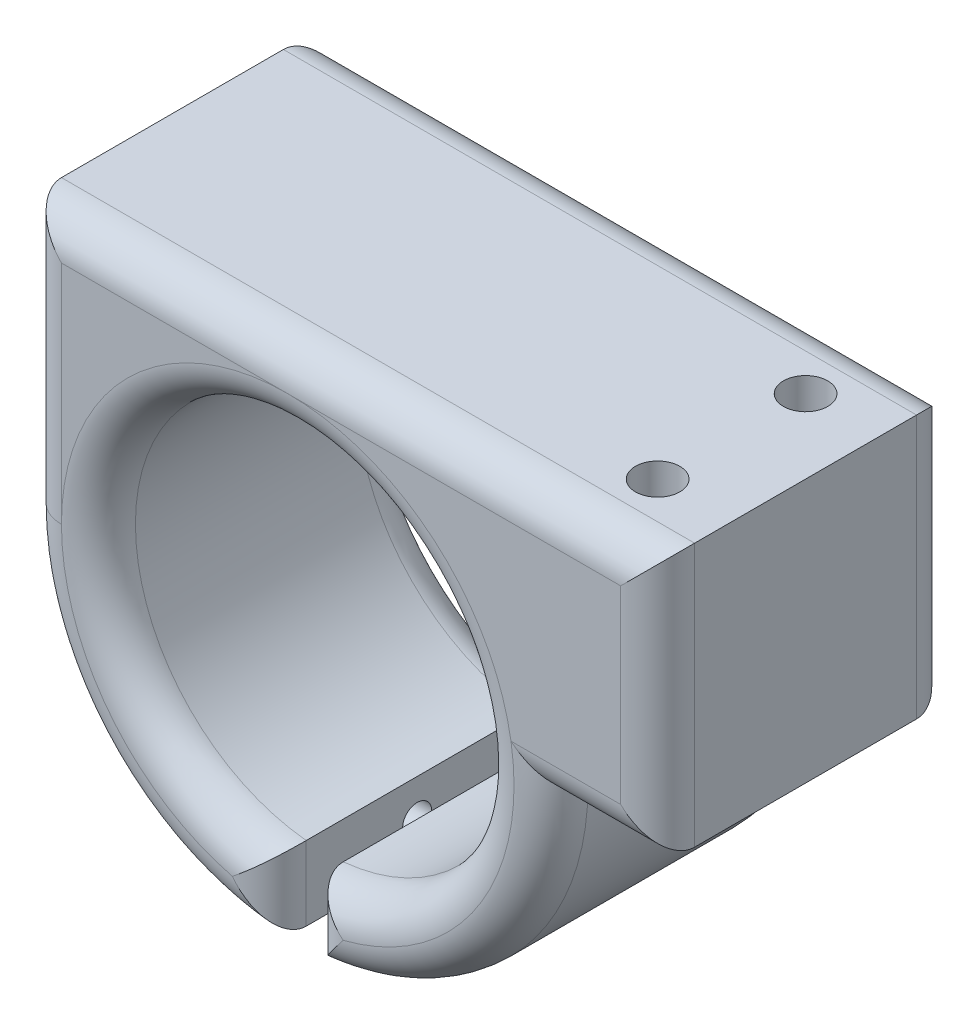
from build123d import *

# Parameters (mm, degrees)
SKETCH2_W           = 25.4
SKETCH2_H           = 50.8
SKETCH2_R           = 3.81
BOSS_EXTRUDE1_DEPTH = 25.4
BOSS_EXTRUDE2_DEPTH = 25.4
CUT_EXTRUDE1_DEPTH  = 170.18
CUT_EXTRUDE2_DEPTH  = 170.18
SKETCH5_3_W         = 19.05
SKETCH5_3_H         = 8.255
SKETCH5_3_R         = 2.5
CUT_EXTRUDE3_DEPTH  = 32.004
SKETCH6_R           = 3.81
CUT_EXTRUDE4_DEPTH  = 32.004
FILLET1_R           = 6.35


with BuildPart() as part:
    # Sketch2 → Boss-Extrude1 (new body)
    with BuildSketch(Plane(origin=(0, 0, 0), x_dir=(1, 0, 0), z_dir=(0, 1, 0))):
        with Locations((-31.75, 0)):
            Rectangle(SKETCH2_W, SKETCH2_H)
        with Locations(Location((-31.75, -12.7, 0), (0, 0, 270))):
            Circle(SKETCH2_R, mode=Mode.SUBTRACT)
        with Locations(Location((-31.75, 12.7, 0), (0, 0, 270))):
            Circle(SKETCH2_R, mode=Mode.SUBTRACT)
    extrude(amount=-BOSS_EXTRUDE1_DEPTH)

    # Sketch3 → Boss-Extrude2 (add, symmetric)
    with BuildSketch(Plane.XY):
        with BuildLine():
            Line((-44.45, -25.4), (-44.45, 0))
            Line((-44.45, 0), (-127.75, 0))
            Line((-127.75, 0), (-127.75, -45.2))
            Line((-127.75, -45.2), (-115.05, -45.2))
            ThreePointArc((-115.05, -45.2), (-82.55, -12.7), (-50.05, -45.2))
            Line((-50.05, -45.2), (-37.35, -45.2))
            Line((-37.35, -45.2), (-19.05, -45.2))
            Line((-19.05, -45.2), (-19.05, -25.4))
            Line((-19.05, -25.4), (-44.45, -25.4))
        make_face()
        with BuildLine():
            Line((-115.05, -45.2), (-127.75, -45.2))
            ThreePointArc((-127.75, -45.2), (-82.55, -90.4), (-37.35, -45.2))
            Line((-37.35, -45.2), (-50.05, -45.2))
            ThreePointArc((-50.05, -45.2), (-82.55, -77.7), (-115.05, -45.2))
        make_face()
    extrude(amount=BOSS_EXTRUDE2_DEPTH, both=True)

    # Sketch4 → Cut-Extrude1 (cut)
    with BuildSketch(Plane.XY.offset(25.4)):
        with BuildLine():
            Line((-85.725, -90.288350768), (-85.725, -104.566683373))
            Line((-85.725, -104.566683373), (-79.375, -104.566683373))
            Line((-79.375, -104.566683373), (-79.375, -90.288350768))
            ThreePointArc((-79.375, -90.288350768), (-82.55, -90.4), (-85.725, -90.288350768))
        make_face()
        with BuildLine():
            ThreePointArc((-50.05, -45.2), (-104.379595736, -21.122650686), (-85.725, -77.544541657))
            Line((-85.725, -77.544541657), (-85.725, -50.833316627))
            Line((-85.725, -50.833316627), (-79.375, -50.833316627))
            Line((-79.375, -50.833316627), (-79.375, -77.544541657))
            ThreePointArc((-79.375, -77.544541657), (-58.472650686, -67.029595736), (-50.05, -45.2))
        make_face()
        with BuildLine():
            Line((-85.725, -50.833316627), (-85.725, -77.544541657))
            ThreePointArc((-85.725, -77.544541657), (-82.55, -77.7), (-79.375, -77.544541657))
            Line((-79.375, -77.544541657), (-79.375, -50.833316627))
            Line((-79.375, -50.833316627), (-85.725, -50.833316627))
        make_face()
        with BuildLine():
            Line((-85.725, -77.544541657), (-85.725, -90.288350768))
            ThreePointArc((-85.725, -90.288350768), (-82.55, -90.4), (-79.375, -90.288350768))
            Line((-79.375, -90.288350768), (-79.375, -77.544541657))
            ThreePointArc((-79.375, -77.544541657), (-82.55, -77.7), (-85.725, -77.544541657))
        make_face()
    extrude(amount=-CUT_EXTRUDE1_DEPTH, mode=Mode.SUBTRACT)

    # Sketch5 → Cut-Extrude2 (cut)
    with BuildSketch(Plane.ZY.offset(127.75)):
        with BuildLine():
            ThreePointArc((2.5, -83.916446213), (1.767766953, -82.14867926), (0, -81.416446213))
            Line((0, -81.416446213), (0, -86.416446213))
            ThreePointArc((0, -86.416446213), (1.767766953, -85.684213166), (2.5, -83.916446213))
        make_face()
        with BuildLine():
            Line((0, -86.416446213), (0, -81.416446213))
            ThreePointArc((0, -81.416446213), (-2.5, -83.916446213), (0, -86.416446213))
        make_face()
    extrude(amount=-CUT_EXTRUDE2_DEPTH, mode=Mode.SUBTRACT)

    # Sketch5<3> → Cut-Extrude3 (cut)
    with BuildSketch(Plane.ZY.offset(127.75)):
        with Locations((0, -83.916446213)):
            Rectangle(SKETCH5_3_W, SKETCH5_3_H)
        with Locations(Location((0, -83.916446213, 0), (0, 0, 270))):
            Circle(SKETCH5_3_R, mode=Mode.SUBTRACT)
    cut_extrude3 = extrude(amount=-CUT_EXTRUDE3_DEPTH, mode=Mode.SUBTRACT)

    # Mirror1: Cut-Extrude3 across plane
    add(cut_extrude3.mirror(Plane.ZY.offset(82.55)), mode=Mode.SUBTRACT)

    # Sketch6 → Cut-Extrude4 (cut)
    with BuildSketch(Plane(origin=(0, -25.4, 0), x_dir=(1, 0, 0), z_dir=(0, 1, 0))):
        with Locations(Location((-31.75, -12.7, 0), (0, 0, 270))):
            Circle(SKETCH6_R)
        with Locations(Location((-31.75, 12.7, 0), (0, 0, 270))):
            Circle(SKETCH6_R)
    extrude(amount=-CUT_EXTRUDE4_DEPTH, mode=Mode.SUBTRACT)

    # Fillet1
    # the kernel refuses this fillet: 6.35 mm, written as the material it takes off along each edge
    with BuildSketch(Plane(origin=(-19.05, -61.075, 25.4), x_dir=(-1, 0, 0), z_dir=(0, 1, 0))) as fillet1_piece_1:
        with BuildLine():
            CenterArc((FILLET1_R, -FILLET1_R), FILLET1_R, 90, 90)
            Line((0, -FILLET1_R), (0, 0))
            Line((0, 0), (FILLET1_R, 0))
        make_face()
    extrude(amount=76.95, mode=Mode.SUBTRACT)
    with BuildSketch(Plane(origin=(-19.05, -61.075, -25.4), x_dir=(-1, 0, 0), z_dir=(0, 1, 0))) as fillet1_piece_2:
        with BuildLine():
            CenterArc((FILLET1_R, FILLET1_R), FILLET1_R, 180, 90)
            Line((0, FILLET1_R), (0, 0))
            Line((0, 0), (FILLET1_R, 0))
        make_face()
    extrude(amount=76.95, mode=Mode.SUBTRACT)
    with BuildSketch(Plane(origin=(-82.55, -45.2, -25.4), x_dir=(-1, 0, 0), z_dir=(0, 1, 0))) as fillet1_piece_3:
        with BuildLine():
            CenterArc((45.2 - FILLET1_R, FILLET1_R), FILLET1_R, 270, 90)
            Line((45.2, FILLET1_R), (45.2, 0))
            Line((45.2, 0), (45.2 - FILLET1_R, 0))
        make_face()
    revolve(axis=Axis((-82.55, -45.2, -25.4), (0, 0, 1)), revolution_arc=106.102651965, mode=Mode.SUBTRACT)
    with BuildSketch(Plane(origin=(-53.225, -45.2, 25.4), x_dir=(0, 1, 0), z_dir=(1, 0, 0))) as fillet1_piece_4_section:
        with BuildLine():
            CenterArc((FILLET1_R, -FILLET1_R), FILLET1_R, 90, 90)
            Line((0, -FILLET1_R), (0, 0))
            Line((0, 0), (FILLET1_R, 0))
        make_face()
    fillet1_piece_4 = extrude(amount=50.05, mode=Mode.PRIVATE)
    fillet1_piece_4 = fillet1_piece_4 - Plane(origin=(-82.55, -45.2, 23.963727381), x_dir=(-1, 0, 0), z_dir=(0, 0, 1)) * Cylinder(45.2, 126, mode=Mode.PRIVATE)
    add(fillet1_piece_4, mode=Mode.SUBTRACT)
    with BuildSketch(Plane(origin=(-127.75, 15.875, -25.4), x_dir=(1, 0, 0), z_dir=(0, -1, 0))) as fillet1_piece_5:
        with BuildLine():
            CenterArc((FILLET1_R, FILLET1_R), FILLET1_R, 180, 90)
            Line((0, FILLET1_R), (0, 0))
            Line((0, 0), (FILLET1_R, 0))
        make_face()
    extrude(amount=61.075, mode=Mode.SUBTRACT)
    with BuildSketch(Plane(origin=(-82.55, -45.2, 25.4), x_dir=(-1, 0, 0), z_dir=(0, 1, 0))) as fillet1_piece_6:
        with BuildLine():
            CenterArc((45.2 - FILLET1_R, -FILLET1_R), FILLET1_R, 360, 90)
            Line((45.2, -FILLET1_R), (45.2, 0))
            Line((45.2, 0), (45.2 - FILLET1_R, 0))
        make_face()
    revolve(axis=Axis((-82.55, -45.2, 25.4), (0, 0, 1)), revolution_arc=106.102651965, mode=Mode.SUBTRACT)
    with BuildSketch(Plane(origin=(-127.75, 15.875, 25.4), x_dir=(1, 0, 0), z_dir=(0, -1, 0))) as fillet1_piece_7:
        with BuildLine():
            CenterArc((FILLET1_R, -FILLET1_R), FILLET1_R, 90, 90)
            Line((0, -FILLET1_R), (0, 0))
            Line((0, 0), (FILLET1_R, 0))
        make_face()
    extrude(amount=61.075, mode=Mode.SUBTRACT)
    with BuildSketch(Plane(origin=(-3.175, -45.2, -25.4), x_dir=(0, 0, 1), z_dir=(-1, 0, 0))) as fillet1_piece_8_section:
        with BuildLine():
            CenterArc((FILLET1_R, FILLET1_R), FILLET1_R, 180, 90)
            Line((0, FILLET1_R), (0, 0))
            Line((0, 0), (FILLET1_R, 0))
        make_face()
    fillet1_piece_8 = extrude(amount=50.05, mode=Mode.PRIVATE)
    fillet1_piece_8 = fillet1_piece_8 - Plane(origin=(-82.55, -45.2, -23.963731438), x_dir=(-1, 0, 0), z_dir=(0, 0, 1)) * Cylinder(45.2, 126, mode=Mode.PRIVATE)
    add(fillet1_piece_8, mode=Mode.SUBTRACT)
    with BuildSketch(Plane(origin=(-82.55, -45.2, -25.4), x_dir=(-0.2773591231629705, -0.9607663174769753, 0), z_dir=(-0.9607663174769753, 0.2773591231629705, 0))) as fillet1_piece_9:
        with BuildLine():
            CenterArc((45.2 - FILLET1_R, FILLET1_R), FILLET1_R, 270, 90)
            Line((45.2, FILLET1_R), (45.2, 0))
            Line((45.2, 0), (45.2 - FILLET1_R, 0))
        make_face()
    revolve(axis=Axis((-82.55, -45.2, -25.4), (0, 0, 1)), revolution_arc=106.102651965, mode=Mode.SUBTRACT)
    with BuildSketch(Plane(origin=(-82.55, -45.2, 25.4), x_dir=(-0.27735912316299666, -0.9607663174769677, 0), z_dir=(-0.9607663174769677, 0.27735912316299666, 0))) as fillet1_piece_10:
        with BuildLine():
            CenterArc((45.2 - FILLET1_R, -FILLET1_R), FILLET1_R, 0, 90)
            Line((45.2, -FILLET1_R), (45.2, 0))
            Line((45.2, 0), (45.2 - FILLET1_R, 0))
        make_face()
    revolve(axis=Axis((-82.55, -45.2, 25.4), (0, 0, 1)), revolution_arc=106.102651965, mode=Mode.SUBTRACT)
    with BuildSketch(Plane(origin=(-82.55, -45.2, 25.4), x_dir=(-0.0031415874858820546, -0.9999950652018581, 0), z_dir=(0.9999950652018581, -0.0031415874858820546, 0))) as fillet1_piece_11:
        with BuildLine():
            CenterArc((32.5 + FILLET1_R, FILLET1_R), FILLET1_R, 180, 90)
            Line((32.5, FILLET1_R), (32.5, 0))
            Line((32.5, 0), (32.5 + FILLET1_R, 0))
        make_face()
    revolve(axis=Axis((-82.55, -45.2, 25.4), (0, 0, -1)), revolution_arc=359.64, mode=Mode.SUBTRACT)
    with BuildSketch(Plane(origin=(-82.55, -45.2, -25.4), x_dir=(-0.003141587485896922, -0.9999950652018581, 0), z_dir=(0.9999950652018581, -0.003141587485896922, 0))) as fillet1_piece_12:
        with BuildLine():
            CenterArc((32.5 + FILLET1_R, -FILLET1_R), FILLET1_R, 90, 90)
            Line((32.5, -FILLET1_R), (32.5, 0))
            Line((32.5, 0), (32.5 + FILLET1_R, 0))
        make_face()
    revolve(axis=Axis((-82.55, -45.2, -25.4), (0, 0, -1)), revolution_arc=359.64, mode=Mode.SUBTRACT)
    with BuildSketch(Plane(origin=(-79.375, -61.669541657, -25.4), x_dir=(1, 0, 0), z_dir=(0, -1, 0)), Plane(origin=(-85.725, -106.163350768, -25.4), x_dir=(-1, 0, 0), z_dir=(0, 1, 0))) as fillet1_piece_13:
        with BuildLine():
            CenterArc((FILLET1_R, FILLET1_R), FILLET1_R, 180, 90)
            Line((0, FILLET1_R), (0, 0))
            Line((0, 0), (FILLET1_R, 0))
        make_face()
    extrude(amount=44.493809111, mode=Mode.SUBTRACT)
    with BuildSketch(Plane(origin=(-79.375, -61.669541657, 25.4), x_dir=(1, 0, 0), z_dir=(0, -1, 0)), Plane(origin=(-85.725, -106.163350768, 25.4), x_dir=(-1, 0, 0), z_dir=(0, 1, 0))) as fillet1_piece_14:
        with BuildLine():
            CenterArc((FILLET1_R, -FILLET1_R), FILLET1_R, 90, 90)
            Line((0, -FILLET1_R), (0, 0))
            Line((0, 0), (FILLET1_R, 0))
        make_face()
    extrude(amount=44.493809111, mode=Mode.SUBTRACT)
    with BuildSketch(Plane(origin=(-3.175, 0, 25.4), x_dir=(0, -1, 0), z_dir=(-1, 0, 0))) as fillet1_piece_15:
        with BuildLine():
            CenterArc((FILLET1_R, -FILLET1_R), FILLET1_R, 90, 90)
            Line((0, -FILLET1_R), (0, 0))
            Line((0, 0), (FILLET1_R, 0))
        make_face()
    extrude(amount=140.45, mode=Mode.SUBTRACT)
    with BuildSketch(Plane(origin=(-3.175, 0, -25.4), x_dir=(0, -1, 0), z_dir=(-1, 0, 0))) as fillet1_piece_16:
        with BuildLine():
            CenterArc((FILLET1_R, FILLET1_R), FILLET1_R, 180, 90)
            Line((0, FILLET1_R), (0, 0))
            Line((0, 0), (FILLET1_R, 0))
        make_face()
    extrude(amount=140.45, mode=Mode.SUBTRACT)
    with BuildSketch(Plane(origin=(-82.55, -45.2, 25.4), x_dir=(-0.27735912316299666, -0.9607663174769677, 0), z_dir=(-0.9607663174769677, 0.27735912316299666, 0))) as fillet1_piece_17a_section:
        with BuildLine():
            CenterArc((45.2 - FILLET1_R, -FILLET1_R), FILLET1_R, 0, 90)
            Line((45.2, -FILLET1_R), (45.2, 0))
            Line((45.2, 0), (45.2 - FILLET1_R, 0))
        make_face()
    fillet1_piece_17a = revolve(axis=Axis((-82.55, -45.2, 25.4), (0, 0, 1)), revolution_arc=126.233269218, mode=Mode.PRIVATE)
    fillet1_piece_17a = split(fillet1_piece_17a, bisect_by=Plane(origin=(-39.640485511, -45.2, 23.937092518), z_dir=(0, 1, 0)), keep=Keep.TOP, mode=Mode.PRIVATE)
    with BuildSketch(Plane(origin=(-53.225, -45.2, 25.4), x_dir=(0, 1, 0), z_dir=(1, 0, 0))) as fillet1_piece_17b_section:
        with BuildLine():
            CenterArc((FILLET1_R, -FILLET1_R), FILLET1_R, 90, 90)
            Line((0, -FILLET1_R), (0, 0))
            Line((0, 0), (FILLET1_R, 0))
        make_face()
    fillet1_piece_17b = extrude(amount=50.05, mode=Mode.PRIVATE)
    fillet1_piece_17b = fillet1_piece_17b & Plane(origin=(-82.55, -45.2, 23.959488183), x_dir=(-1, 0, 0), z_dir=(0, 0, 1)) * Cylinder(45.2, 126, mode=Mode.PRIVATE)
    fillet1_piece_17 = fillet1_piece_17a & fillet1_piece_17b
    add(fillet1_piece_17, mode=Mode.SUBTRACT)
    with BuildSketch(Plane(origin=(-3.175, -45.2, -25.4), x_dir=(0, 0, 1), z_dir=(-1, 0, 0))) as fillet1_piece_18a_section:
        with BuildLine():
            CenterArc((FILLET1_R, FILLET1_R), FILLET1_R, 180, 90)
            Line((0, FILLET1_R), (0, 0))
            Line((0, 0), (FILLET1_R, 0))
        make_face()
    fillet1_piece_18a = extrude(amount=50.05, mode=Mode.PRIVATE)
    fillet1_piece_18a = fillet1_piece_18a & Plane(origin=(-82.55, -45.2, -23.959492229), x_dir=(-1, 0, 0), z_dir=(0, 0, 1)) * Cylinder(45.2, 126, mode=Mode.PRIVATE)
    with BuildSketch(Plane(origin=(-82.55, -45.2, -25.4), x_dir=(-0.2773591231629705, -0.9607663174769753, 0), z_dir=(-0.9607663174769753, 0.2773591231629705, 0))) as fillet1_piece_18b_section:
        with BuildLine():
            CenterArc((45.2 - FILLET1_R, FILLET1_R), FILLET1_R, 270, 90)
            Line((45.2, FILLET1_R), (45.2, 0))
            Line((45.2, 0), (45.2 - FILLET1_R, 0))
        make_face()
    fillet1_piece_18b = revolve(axis=Axis((-82.55, -45.2, -25.4), (0, 0, 1)), revolution_arc=126.233269218, mode=Mode.PRIVATE)
    fillet1_piece_18b = split(fillet1_piece_18b, bisect_by=Plane(origin=(-39.640485499, -45.2, -23.937092515), z_dir=(0, 1, 0)), keep=Keep.TOP, mode=Mode.PRIVATE)
    fillet1_piece_18 = fillet1_piece_18a & fillet1_piece_18b
    add(fillet1_piece_18, mode=Mode.SUBTRACT)


solid = part.part
